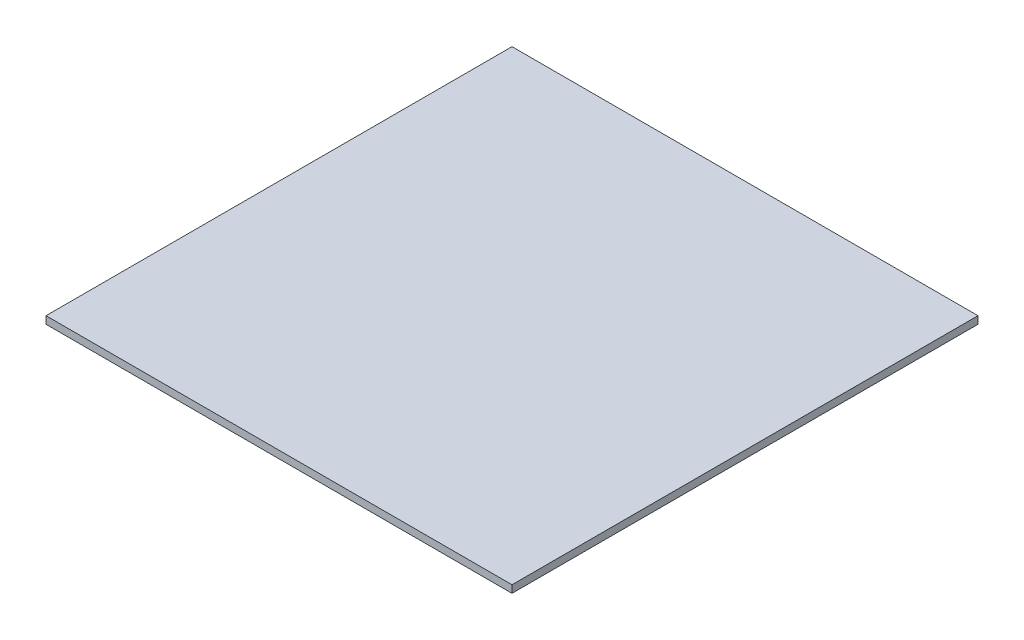
from build123d import *

# Parameters (mm, degrees)
SKETCH1_W           = 250
SKETCH1_H           = 250
BOSS_EXTRUDE1_DEPTH = 4


with BuildPart() as part:
    # Sketch1 → Boss-Extrude1 (new body)
    with BuildSketch(Plane(origin=(0, 0, 0), x_dir=(1, 0, 0), z_dir=(0, 1, 0))):
        with Locations((125, -125)):
            Rectangle(SKETCH1_W, SKETCH1_H)
    extrude(amount=BOSS_EXTRUDE1_DEPTH)


solid = part.part
